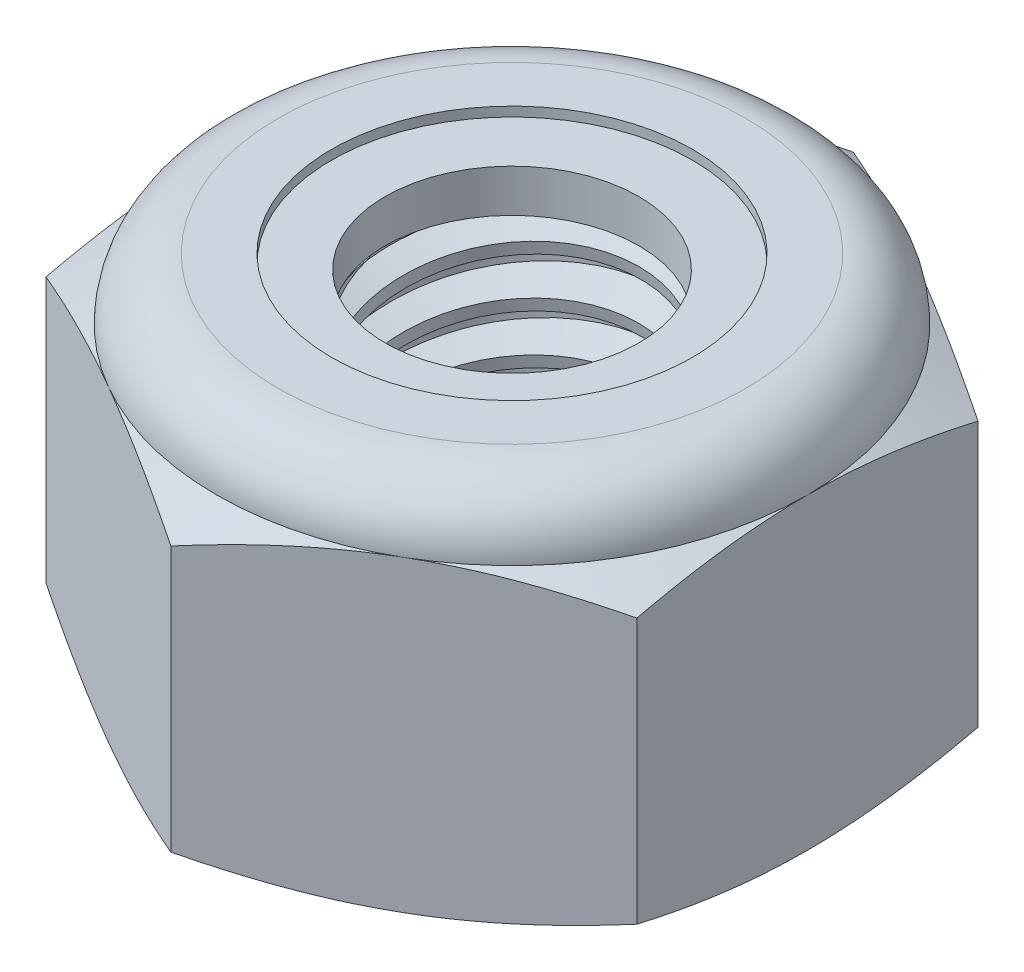
from build123d import *

# Parameters (mm, degrees)
EXTRUDE1_DEPTH       = 5.953125
SKETCH2_W            = 2.413
SKETCH2_H            = 5.953125
LPATTERN1_COUNT      = 8
LPATTERN1_PITCH      = 0.79375
LPATTERN1_COUNT_DIR2 = 2
LPATTERN1_PITCH_DIR2 = 0.79375


with BuildPart() as part:
    # Sketch1 → Extrude1 (new body)
    with BuildSketch(Plane(origin=(0, 0, 0), x_dir=(1, 0, 0), z_dir=(0, 1, 0))):
        Polygon((0, 5.499261314), (-4.7625, 2.749630657), (-4.7625, -2.749630657), (0, -5.499261314), (4.7625, -2.749630657), (4.7625, 2.749630657), align=None)
    extrude(amount=EXTRUDE1_DEPTH)

    # Sketch4 → Cut-Revolve2 (revolve, cut)
    with BuildSketch(Plane(origin=(0, 0, 0), x_dir=(0, 0, -1), z_dir=(1, 0, 0))):
        Polygon((0, 5.953125), (2.413, 5.953125), (2.045424837, 5.781721887), (2.045424837, 0.171403113), (2.413, 0), (0, 0), align=None)
    revolve(axis=Axis((0, 5.953125, 0), (0, 1, 0)), mode=Mode.SUBTRACT)


with BuildPart() as body_2:
    # Sketch2 → Revolve1 (revolve)
    with BuildSketch(Plane(origin=(0, 0, 0), x_dir=(0, 0, -1), z_dir=(1, 0, 0))):
        with Locations((1.2065, 2.9765625)):
            Rectangle(SKETCH2_W, SKETCH2_H)
    revolve(axis=Axis((0, -2.413, 0), (0, 1, 0)))

    # Sketch3 → Cut-Revolve1 (revolve, cut)
    with BuildSketch(Plane(origin=(0, 0, 0), x_dir=(0, 0, -1), z_dir=(1, 0, 0))):
        Polygon((2.429102527, 5.855221635), (2.541820218, 5.169898076), (2.077629892, 5.344930502), (2.045424837, 5.540737233), align=None)
    cut_revolve1 = revolve(axis=Axis((0, 5.953125, 0.139697061), (0, -0.9867425810390564, -0.1622931876708975)), mode=Mode.SUBTRACT)

    # LPattern1: Cut-Revolve1 8 × 2
    with Locations(*[Vector(0, -1, 0) * (i * LPATTERN1_PITCH) + Vector(0, 1, 0) * (j * LPATTERN1_PITCH_DIR2) for i in range(LPATTERN1_COUNT) for j in range(LPATTERN1_COUNT_DIR2) if (i, j) != (0, 0)]):
        add(cut_revolve1, mode=Mode.SUBTRACT)


with BuildPart() as part_1:
    add(part.part)

    # Combine1: cut body 2
    add(body_2.part, mode=Mode.SUBTRACT)

    # Sketch5 → Cut-Revolve3 (revolve, cut)
    with BuildSketch(Plane(origin=(0, 0, 0), x_dir=(0, 0, -1), z_dir=(1, 0, 0))):
        with BuildLine():
            Line((0, 0), (4.7625, 0))
            Line((4.7625, 0), (5.499261314, 0.343557443))
            Line((5.499261314, 0.343557443), (5.499261314, 4.617380057))
            Line((5.499261314, 4.617380057), (4.7625, 4.9609375))
            ThreePointArc((4.7625, 4.9609375), (4.471895009, 5.662520009), (3.7703125, 5.953125))
            Line((3.7703125, 5.953125), (3.7703125, 7.223125))
            Line((3.7703125, 7.223125), (6.769261314, 7.223125))
            Line((6.769261314, 7.223125), (6.769261314, -1.27))
            Line((6.769261314, -1.27), (0, -1.27))
            Line((0, -1.27), (0, 0))
        make_face()
    revolve(axis=Axis((0, 0, 0), (0, 1, 0)), mode=Mode.SUBTRACT)

    # Sketch6 → Cut-Revolve4 (revolve, cut)
    with BuildSketch(Plane(origin=(0, 0, 0), x_dir=(0, 0, -1), z_dir=(1, 0, 0))):
        with BuildLine():
            Line((0, 4.9609375), (4.6101, 4.9609375))
            ThreePointArc((4.6101, 4.9609375), (4.364131936, 5.554756936), (3.7703125, 5.800725))
            Line((3.7703125, 5.800725), (2.907868669, 5.800725))
            Line((2.907868669, 5.800725), (2.907868669, 7.223125))
            Line((2.907868669, 7.223125), (0, 7.223125))
            Line((0, 7.223125), (0, 4.9609375))
        make_face()
    revolve(axis=Axis((0, 7.223125, 0), (0, 1, 0)), mode=Mode.SUBTRACT)


with BuildPart() as body_2_2:
    # Sketch7 → Revolve2 (revolve)
    with BuildSketch(Plane(origin=(0, 0, 0), x_dir=(0, 0, -1), z_dir=(1, 0, 0))):
        with BuildLine():
            Line((2.045424837, 5.0371375), (4.530088408, 5.0371375))
            ThreePointArc((4.530088408, 5.0371375), (4.282601726, 5.527175629), (3.7703125, 5.724525))
            Line((3.7703125, 5.724525), (2.045424837, 5.724525))
            Line((2.045424837, 5.724525), (2.045424837, 5.0371375))
        make_face()
    revolve(axis=Axis((0, 5.0371375, 0), (0, 1, 0)))


solid = Compound([part_1.part, body_2_2.part])
